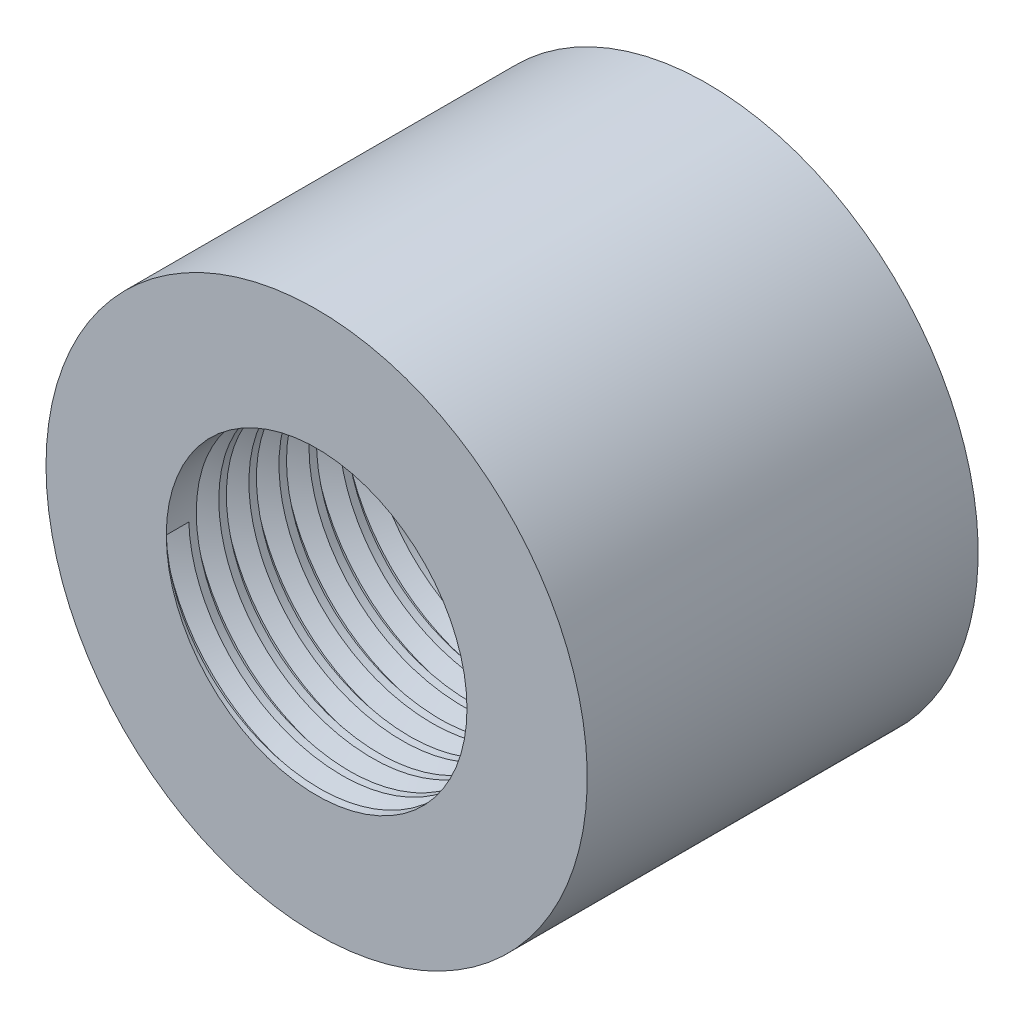
from build123d import *

# Parameters (mm, degrees)
SKETCH1_R           = 9
SKETCH1_R_2         = 5
BOSS_EXTRUDE1_DEPTH = 13
SKETCH4_R           = 7
CUT_EXTRUDE1_DEPTH  = 3
THREAD1_PITCH       = 1


with BuildPart() as part:
    # Sketch1 → Boss-Extrude1 (new body)
    with BuildSketch(Plane.XY):
        with Locations(Location((0, 0, 0), (0, 0, 180))):
            Circle(SKETCH1_R)
        with Locations(Location((0, 0, 0), (0, 0, 180))):
            Circle(SKETCH1_R_2, mode=Mode.SUBTRACT)
    extrude(amount=BOSS_EXTRUDE1_DEPTH)

    # Sketch4 → Cut-Extrude1 (cut)
    with BuildSketch(Plane(origin=(0, 0, 0), x_dir=(-1, 0, 0), z_dir=(0, 0, -1))):
        Circle(SKETCH4_R)
    extrude(amount=-CUT_EXTRUDE1_DEPTH, mode=Mode.SUBTRACT)

    # Thread1: the profile of Thread Profile2 profile screwed along a left-hand helix of 10 turns, 8 arcs to a turn; built about Z, then put on its axis
    thread1_z = Axis((0, 0, 0), (0, 0, 1))
    thread1_corners = [(4.9997, 0, -0.000173205), (5.541265875, 0, 0.312499999), (5.541265875, 0, 0.437499999), (4.9997, 0, 0.750173202)]
    with BuildLine(mode=Mode.PRIVATE) as thread1_profile:
        Line(thread1_corners[0], thread1_corners[1])
        Line(thread1_corners[1], thread1_corners[2])
        Line(thread1_corners[2], thread1_corners[3])
        Line(thread1_corners[3], thread1_corners[0])
    thread1_cap = Face(thread1_profile.wire())
    thread1_turn_angles = [0, -22.5, -45, -67.5, -90, -112.5, -135, -157.5, -180, -202.5, -225, -247.5, -270, -292.5, -315, -337.5, -360]
    thread1_turn_weights = [1, 0.9238795325112867, 1, 0.9238795325112867, 1, 0.9238795325112867, 1, 0.9238795325112867, 1, 0.9238795325112867, 1, 0.9238795325112867, 1, 0.9238795325112867, 1, 0.9238795325112867, 1]
    thread1_turn_rails = [Edge.make_bspline([Vector(p[0], p[1], 0).rotate(thread1_z, thread1_turn_angles[k]) / thread1_turn_weights[k] + Vector(0, 0, p[2] + -THREAD1_PITCH * thread1_turn_angles[k] / 360) for k in range(17)], [0, 0, 0, 1, 1, 2, 2, 3, 3, 4, 4, 5, 5, 6, 6, 7, 7, 8, 8, 8], 2, thread1_turn_weights) for p in thread1_corners]
    thread1_turn_sides = [Face.make_surface_from_curves(thread1_turn_rails[p[0]], thread1_turn_rails[p[1]]) for p in [(0, 1), (1, 2), (2, 3), (3, 0)]]
    thread1 = Plane(origin=(0, 0, 13), x_dir=(-1, 0, 0), z_dir=(0, 0, -1)) * Solid(Shell([*[p.moved(Location((0, 0, THREAD1_PITCH * i))) for i in range(10) for p in thread1_turn_sides], thread1_cap, thread1_cap.rotate(thread1_z, -3600).moved(Location((0, 0, -THREAD1_PITCH * -3600 / 360)))]))
    add(thread1, mode=Mode.SUBTRACT)


solid = part.part
